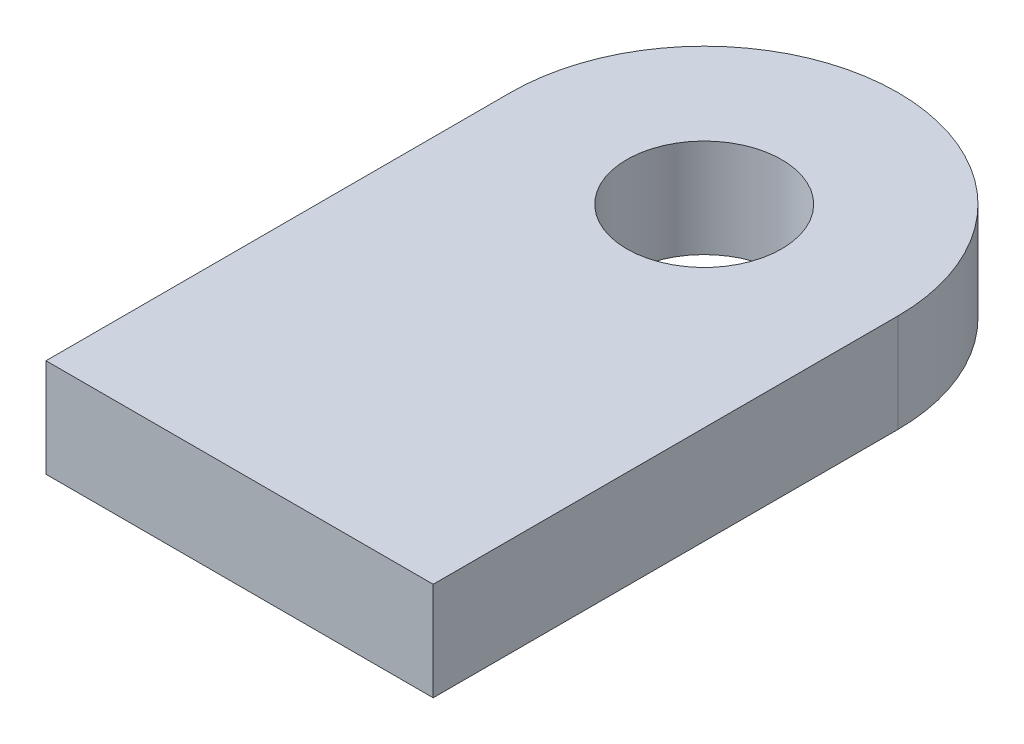
from build123d import *

# Parameters (mm, degrees)
SKETCH1_R           = 5
BOSS_EXTRUDE1_DEPTH = 6.35


with BuildPart() as part:
    # Sketch1 → Boss-Extrude1 (new body)
    with BuildSketch(Plane(origin=(0, 0, 0), x_dir=(1, 0, 0), z_dir=(0, 1, 0))):
        with BuildLine():
            Line((2.22, 9.797498044), (2.22, 39.797498044))
            ThreePointArc((2.22, 39.797498044), (-10.28, 52.297498044), (-22.78, 39.797498044))
            Line((-22.78, 39.797498044), (-22.78, 9.797498044))
            Line((-22.78, 9.797498044), (2.22, 9.797498044))
        make_face()
        with Locations((-10.28, 39.797498044)):
            Circle(SKETCH1_R, mode=Mode.SUBTRACT)
    extrude(amount=BOSS_EXTRUDE1_DEPTH)


solid = part.part
